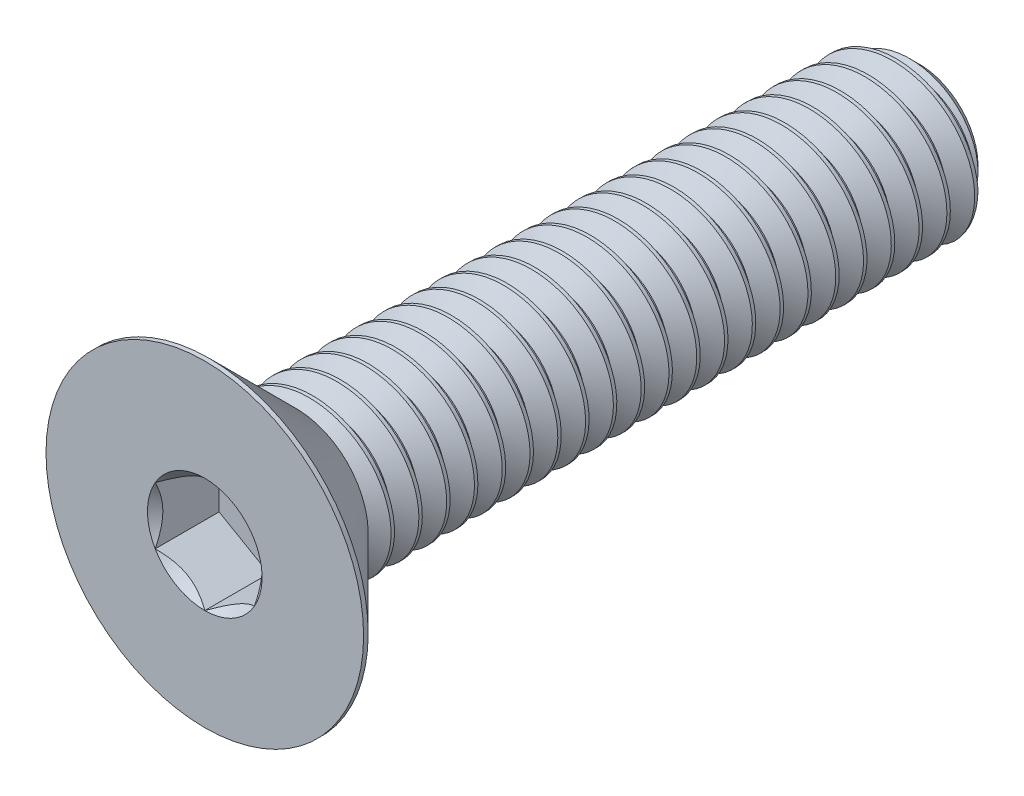
from build123d import *

# Parameters (mm, degrees)
CHAMFER1_SIZE      = 0.525
CUT_EXTRUDE2_DEPTH = 1.61
CUT_SWEEP1_PITCH   = 0.7


with BuildPart() as part:
    # Sketch1 → Revolve1 (revolve)
    with BuildSketch(Plane(origin=(0, 0, 0), x_dir=(0, 0, -1), z_dir=(1, 0, 0)), mode=Mode.PRIVATE) as revolve1_sk:
        Polygon((-6.7, 2), (9, 2), (9, 0), (-7.39, 0), (-7.39, 2), align=None)
    revolve(revolve1_sk.sketch.rotate(Axis((0, 0, 7.39), (0, 0, -1)), 180), axis=Axis((0, 0, 7.39), (0, 0, -1)))

    # Chamfer1
    chamfer1_edges = [part.edges().sort_by_distance(p)[0] for p in [
        (0, 2, -9),
    ]]
    chamfer(chamfer1_edges, length=CHAMFER1_SIZE)

    # Cut-Sweep1: the profile of Sketch13 screwed along a right-hand helix of 25.714286 turns, 6 arcs to a turn; built about Z, then put on its axis
    cut_sweep1_z = Axis((0, 0, 0), (0, 0, 1))
    cut_sweep1_corners = [(2.037888611, 0, 0.021875), (2.037888611, 0, -0.634375), (1.545336663, 0, -0.35), (1.545336663, 0, -0.2625)]
    with BuildLine(mode=Mode.PRIVATE) as cut_sweep1_profile:
        Line(cut_sweep1_corners[0], cut_sweep1_corners[1])
        Line(cut_sweep1_corners[1], cut_sweep1_corners[2])
        Line(cut_sweep1_corners[2], cut_sweep1_corners[3])
        Line(cut_sweep1_corners[3], cut_sweep1_corners[0])
    cut_sweep1_cap = Face(cut_sweep1_profile.wire())
    cut_sweep1_turn_angles = [0, 30, 60, 90, 120, 150, 180, 210, 240, 270, 300, 330, 360]
    cut_sweep1_turn_weights = [1, 0.8660254037844387, 1, 0.8660254037844387, 1, 0.8660254037844387, 1, 0.8660254037844387, 1, 0.8660254037844387, 1, 0.8660254037844387, 1]
    cut_sweep1_turn_rails = [Edge.make_bspline([Vector(p[0], p[1], 0).rotate(cut_sweep1_z, cut_sweep1_turn_angles[k]) / cut_sweep1_turn_weights[k] + Vector(0, 0, p[2] + CUT_SWEEP1_PITCH * cut_sweep1_turn_angles[k] / 360) for k in range(13)], [0, 0, 0, 1, 1, 2, 2, 3, 3, 4, 4, 5, 5, 6, 6, 6], 2, cut_sweep1_turn_weights) for p in cut_sweep1_corners]
    cut_sweep1_turn_sides = [Face.make_surface_from_curves(cut_sweep1_turn_rails[p[0]], cut_sweep1_turn_rails[p[1]]) for p in [(0, 1), (1, 2), (2, 3), (3, 0)]]
    cut_sweep1_last_angles = [9000, 9030, 9060, 9090, 9120, 9150, 9180, 9210, 9240, 9248.571428571, 9257.142857143]
    cut_sweep1_last_weights = [1, 0.8660254037844387, 1, 0.8660254037844387, 1, 0.8660254037844387, 1, 0.8660254037844387, 1, 0.9888308262249916, 1]
    cut_sweep1_last_rails = [Edge.make_bspline([Vector(p[0], p[1], 0).rotate(cut_sweep1_z, cut_sweep1_last_angles[k]) / cut_sweep1_last_weights[k] + Vector(0, 0, p[2] + CUT_SWEEP1_PITCH * cut_sweep1_last_angles[k] / 360) for k in range(11)], [0, 0, 0, 1, 1, 2, 2, 3, 3, 4, 4, 5, 5, 5], 2, cut_sweep1_last_weights) for p in cut_sweep1_corners]
    cut_sweep1_last_sides = [Face.make_surface_from_curves(cut_sweep1_last_rails[p[0]], cut_sweep1_last_rails[p[1]]) for p in [(0, 1), (1, 2), (2, 3), (3, 0)]]
    cut_sweep1 = Plane(origin=(0, 0, -9), x_dir=(0, 1, 0), z_dir=(0, 0, 1)) * Solid(Shell([*[p.moved(Location((0, 0, CUT_SWEEP1_PITCH * i))) for i in range(25) for p in cut_sweep1_turn_sides], *cut_sweep1_last_sides, cut_sweep1_cap, cut_sweep1_cap.rotate(cut_sweep1_z, 9257.142857143).moved(Location((0, 0, CUT_SWEEP1_PITCH * 9257.142857143 / 360)))]))
    add(cut_sweep1, mode=Mode.SUBTRACT)


with BuildPart() as body_2:
    # Sketch7 → Revolve2 (revolve)
    with BuildSketch(Plane(origin=(0, 0, 0), x_dir=(0, 0, -1), z_dir=(1, 0, 0)), mode=Mode.PRIVATE) as revolve2_sk:
        Polygon((-9, 4), (-8.885, 4), (-6.7, 1.815), (-6.7, 0), (-9, 0), align=None)
    revolve(revolve2_sk.sketch.rotate(Axis((0, 0, 9), (0, 0, -1)), 180), axis=Axis((0, 0, 9), (0, 0, -1)))

    # Sketch5 → Cut-Extrude2 (cut)
    with BuildSketch(Plane.XY.offset(9)):
        Polygon((1.25, -0.721687836), (1.25, 0.721687836), (0, 1.443375673), (-1.25, 0.721687836), (-1.25, -0.721687836), (0, -1.443375673), align=None)
    extrude(amount=-CUT_EXTRUDE2_DEPTH, mode=Mode.SUBTRACT)

    # Cut-Extrude3 cone 1 section (through the dimple's axis) → Cut-Extrude3 (revolve, cut)
    with BuildSketch(Plane(origin=(0, 0, 9), x_dir=(0, -1, 0), z_dir=(1, 0, 0))):
        Polygon((0, 0), (1.443375673, 0), (0, 1.443375673), align=None)
    revolve(axis=Axis((0, 0, 9), (0, 0, -1)), mode=Mode.SUBTRACT)

    # Combine1: union part
    add(part.part)


solid = body_2.part
